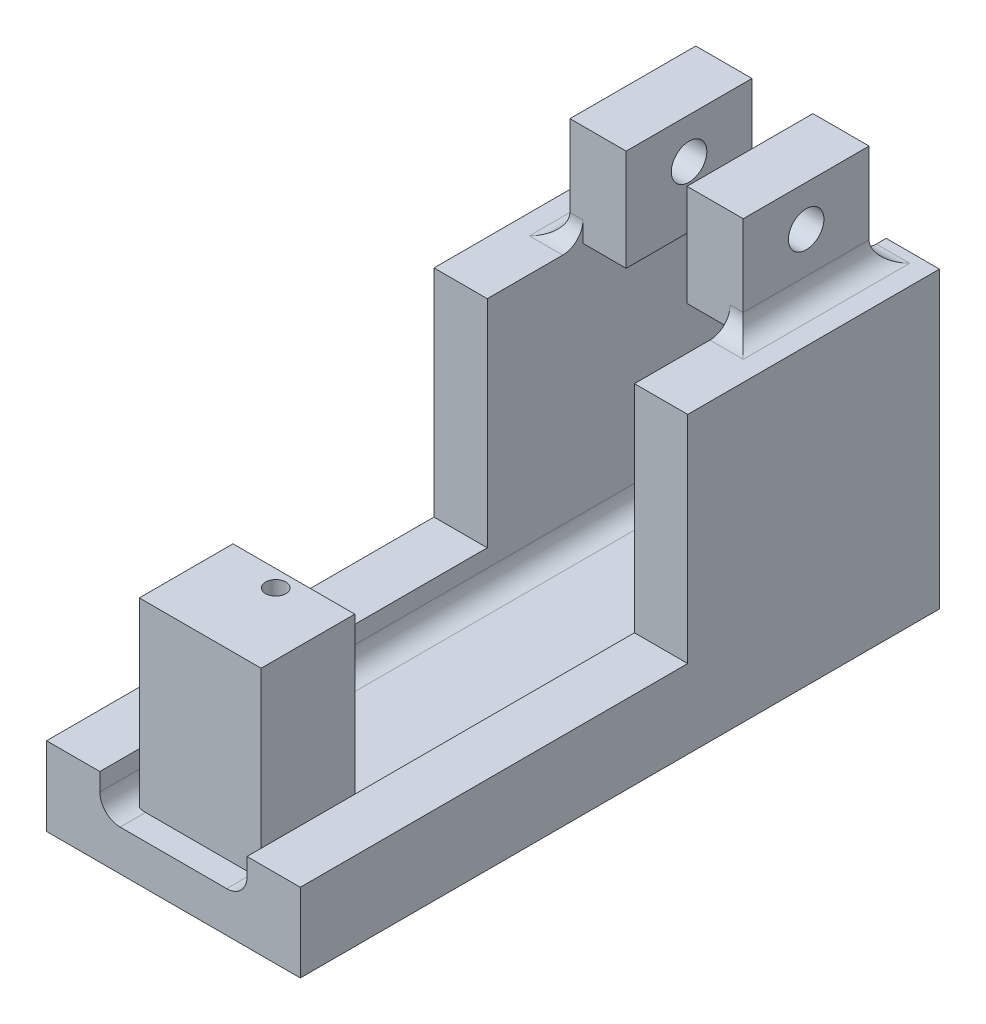
from build123d import *

# Parameters (mm, degrees)
SKETCH1_W           = 25
SKETCH1_H           = 80
BOSS_EXTRUDE1_DEPTH = 4
SKETCH2_W           = 5.25
SKETCH2_H           = 80
BOSS_EXTRUDE2_DEPTH = 25
FILLET1_R           = 2
SKETCH4_W           = 5.536830439
SKETCH4_H           = 12.398418667
BOSS_EXTRUDE4_DEPTH = 10
SKETCH5_R           = 1.75
CUT_EXTRUDE1_DEPTH  = 62.204574992
SKETCH6_W           = 12
SKETCH6_H           = 9.229363682
BOSS_EXTRUDE5_DEPTH = 18
SKETCH7_R           = 1
CUT_EXTRUDE2_DEPTH  = 8
FILLET2_R           = 2
SKETCH8_W           = 25
SKETCH8_H           = 17.031041768
CUT_EXTRUDE3_DEPTH  = 51.963222033
SKETCH11_W          = 38.179755812
SKETCH11_H          = 21.256889565
CUT_EXTRUDE4_DEPTH  = 6
SKETCH12_W          = 8.515859822
SKETCH12_H          = 9.828538211
CUT_EXTRUDE5_DEPTH  = 55.60082417


with BuildPart() as part:
    # Sketch1 → Boss-Extrude1 (new body)
    with BuildSketch(Plane(origin=(0, 0, 0), x_dir=(1, 0, 0), z_dir=(0, 1, 0))):
        Rectangle(SKETCH1_W, SKETCH1_H)
    extrude(amount=BOSS_EXTRUDE1_DEPTH)

    # Sketch2 → Boss-Extrude2 (add)
    with BuildSketch(Plane(origin=(0, 4, 0), x_dir=(1, 0, 0), z_dir=(0, 1, 0))):
        with Locations((-9.875, 0)):
            Rectangle(SKETCH2_W, SKETCH2_H)
    boss_extrude2 = extrude(amount=BOSS_EXTRUDE2_DEPTH)

    # Mirror1: Boss-Extrude2 across plane
    add(boss_extrude2.mirror(Plane(origin=(0, 0, 0), x_dir=(0, 0, 1), z_dir=(1, 0, 0))))

    # Fillet1
    fillet1_edges = [part.edges().sort_by_distance(p)[0] for p in [
        (7.25, 4, 0),
        (-7.25, 4, 0),
    ]]
    fillet(fillet1_edges, radius=FILLET1_R)

    # Sketch4 → Boss-Extrude4 (add)
    with BuildSketch(Plane(origin=(0, 29, 0), x_dir=(1, 0, 0), z_dir=(0, 1, 0))):
        with Locations((-5.76841522, 13.800790666)):
            Rectangle(SKETCH4_W, SKETCH4_H)
        with Locations((5.76841522, 13.800790666)):
            Rectangle(SKETCH4_W, SKETCH4_H)
    extrude(amount=BOSS_EXTRUDE4_DEPTH)

    # Sketch5 → Cut-Extrude1 (cut, through all)
    with BuildSketch(Plane(origin=(12.5, 0, 0), x_dir=(0, 0, -1), z_dir=(1, 0, 0))):
        with Locations((13.800790667, 35)):
            Circle(SKETCH5_R)
    extrude(amount=-CUT_EXTRUDE1_DEPTH, mode=Mode.SUBTRACT)

    # Sketch6 → Boss-Extrude5 (add)
    with BuildSketch(Plane(origin=(0, 4, 0), x_dir=(1, 0, 0), z_dir=(0, 1, 0))):
        with Locations((0.13927086, -32.885318159)):
            Rectangle(SKETCH6_W, SKETCH6_H)
    extrude(amount=BOSS_EXTRUDE5_DEPTH)

    # Sketch7 → Cut-Extrude2 (cut)
    with BuildSketch(Plane(origin=(0, 22, 0), x_dir=(1, 0, 0), z_dir=(0, 1, 0))):
        with Locations((0, -29.920636318)):
            Circle(SKETCH7_R)
    extrude(amount=-CUT_EXTRUDE2_DEPTH, mode=Mode.SUBTRACT)

    # Fillet2
    fillet2_edges = [part.edges().sort_by_distance(p)[0] for p in [
        (-8.536830439, 29, -13.800790667),
        (8.536830439, 29, -13.800790667),
        (-7.89341522, 29, -20),
        (7.89341522, 29, -20),
        (7.89341522, 29, -7.601581333),
        (-7.89341522, 29, -7.601581333),
    ]]
    fillet(fillet2_edges, radius=FILLET2_R)

    # Sketch8 → Cut-Extrude3 (cut, through all)
    with BuildSketch(Plane(origin=(0, 29, 0), x_dir=(1, 0, 0), z_dir=(0, 1, 0))):
        with Locations((0, 31.484479116)):
            Rectangle(SKETCH8_W, SKETCH8_H)
    extrude(amount=-CUT_EXTRUDE3_DEPTH, mode=Mode.SUBTRACT)

    # Sketch11 → Cut-Extrude4 (cut)
    with BuildSketch(Plane.ZY.offset(12.5)):
        with Locations((20.91963235, 18.371555218)):
            Rectangle(SKETCH11_W, SKETCH11_H)
    cut_extrude4 = extrude(amount=-CUT_EXTRUDE4_DEPTH, mode=Mode.SUBTRACT)

    # Mirror2: Cut-Extrude4 across plane
    add(cut_extrude4.mirror(Plane(origin=(0, 0, 0), x_dir=(0, 0, 1), z_dir=(1, 0, 0))), mode=Mode.SUBTRACT)

    # Sketch12 → Cut-Extrude5 (cut, through all)
    with BuildSketch(Plane(origin=(0, 4, 0), x_dir=(1, 0, 0), z_dir=(0, 1, 0))):
        with Locations((0, 15.723146937)):
            Rectangle(SKETCH12_W, SKETCH12_H)
    extrude(amount=-CUT_EXTRUDE5_DEPTH, mode=Mode.SUBTRACT)


solid = part.part
